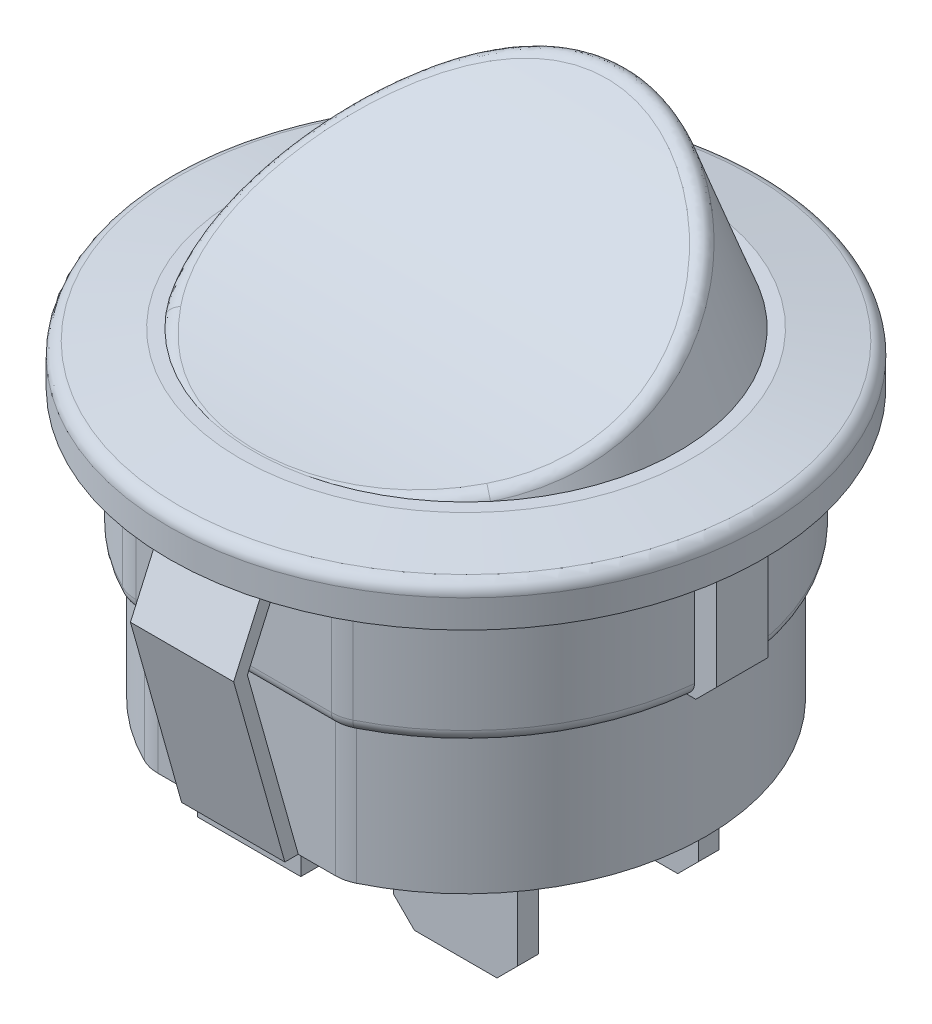
from build123d import *

# Parameters (mm, degrees)
BOSS_EXTRUDE1_DEPTH = 5
SKETCH2_R           = 11.5
BOSS_EXTRUDE2_DEPTH = 2
CHAMFER1_SIZE       = 0.5
CHAMFER1_SIZE2      = 2.75
BOSS_EXTRUDE3_DEPTH = 5.4
SKETCH4_W           = 4.8
SKETCH4_H           = 0.8
BOSS_EXTRUDE4_DEPTH = 8.4
SKETCH5_R           = 0.8
CUT_EXTRUDE1_DEPTH  = 26.045957758
BOSS_EXTRUDE5_DEPTH = 5
CHAMFER2_SIZE       = 0.8
BOSS_EXTRUDE6_DEPTH = 2
SKETCH8_W           = 4
SKETCH8_H           = 1
BOSS_EXTRUDE7_DEPTH = 0.8
CHAMFER3_SIZE       = 0.8
SKETCH9_R           = 8.25
BOSS_EXTRUDE8_DEPTH = 6.2
BOSS_EXTRUDE8_TAPER = 20
SKETCH10_R          = 20.629628058
CUT_EXTRUDE3_DEPTH  = 15
FILLET2_R           = 1.5
FILLET4_R           = 0.5
FILLET5_R           = 0.5
FILLET6_R           = 0.5


with BuildPart() as part:
    # Sketch1 → Boss-Extrude1 (new body)
    with BuildSketch(Plane(origin=(0, 0, 0), x_dir=(1, 0, 0), z_dir=(0, 1, 0))):
        with BuildLine():
            Line((4.124318125, -9), (-4.124318125, -9))
            ThreePointArc((-4.124318125, -9), (-9.9, 0), (-4.124318125, 9))
            Line((-4.124318125, 9), (4.124318125, 9))
            ThreePointArc((4.124318125, 9), (9.9, 0), (4.124318125, -9))
        make_face()
    extrude(amount=-BOSS_EXTRUDE1_DEPTH)

    # Sketch2 → Boss-Extrude2 (add)
    with BuildSketch(Plane(origin=(0, 0, 0), x_dir=(1, 0, 0), z_dir=(0, 1, 0))):
        with Locations(Location((0, 0, 0), (0, 0, 270))):
            Circle(SKETCH2_R)
    extrude(amount=BOSS_EXTRUDE2_DEPTH)

    # Chamfer1
    chamfer1_edges = [part.edges().sort_by_distance(p)[0] for p in [
        (0, 2, -11.5),
    ]]
    chamfer1_side = [part.faces().sort_by_distance(p)[0] for p in [
        (0, 1, -11.5),
    ]]
    chamfer(chamfer1_edges, length=CHAMFER1_SIZE, length2=CHAMFER1_SIZE2, reference=chamfer1_side[0])

    # Sketch3 → Boss-Extrude3 (add)
    with BuildSketch(Plane.XZ.offset(5)):
        with BuildLine():
            Line((-3.773592453, 8.5), (3.773592453, 8.5))
            ThreePointArc((3.773592453, 8.5), (9.3, 0), (3.773592453, -8.5))
            Line((3.773592453, -8.5), (-3.773592453, -8.5))
            ThreePointArc((-3.773592453, -8.5), (-9.3, 0), (-3.773592453, 8.5))
        make_face()
    extrude(amount=BOSS_EXTRUDE3_DEPTH)

    # Sketch4 → Boss-Extrude4 (add)
    with BuildSketch(Plane.XZ.offset(10.4)):
        Rectangle(SKETCH4_W, SKETCH4_H)
        with Locations((0, -7)):
            Rectangle(SKETCH4_W, SKETCH4_H)
    extrude(amount=BOSS_EXTRUDE4_DEPTH)

    # Sketch5 → Cut-Extrude1 (cut, through all)
    with BuildSketch(Plane.XY.offset(0.4)):
        with Locations((0, -15.4)):
            Circle(SKETCH5_R)
        with Locations((-2.4, -12.9)):
            Circle(SKETCH5_R)
        with Locations((2.4, -12.9)):
            Circle(SKETCH5_R)
    extrude(amount=-CUT_EXTRUDE1_DEPTH, mode=Mode.SUBTRACT)

    # Sketch6 → Boss-Extrude5 (add)
    with BuildSketch(Plane.XZ):
        with BuildLine():
            Line((10.7, -1), (10.7, 1))
            Line((10.7, 1), (9.849365462, 1))
            ThreePointArc((9.849365462, 1), (9.9, 0), (9.849365462, -1))
            Line((9.849365462, -1), (10.7, -1))
        make_face()
    extrude(amount=BOSS_EXTRUDE5_DEPTH)

    # Chamfer2
    chamfer2_edges = [part.edges().sort_by_distance(p)[0] for p in [
        (10.7, -5, 0),
    ]]
    chamfer(chamfer2_edges, length=CHAMFER2_SIZE)

    # Sketch7 → Boss-Extrude6 (add, symmetric)
    with BuildSketch(Plane(origin=(0, 0, 0), x_dir=(0, 0, -1), z_dir=(1, 0, 0))):
        Polygon((-9.5, 0), (-11, -3.364211825), (-9.018087581, -10.4), (-8.5, -10.4), (-8.5, -10.395132534), (-10.46970443, -3.402682715), (-9, -0.106418033), (-9, 0), align=None)
    boss_extrude6 = extrude(amount=BOSS_EXTRUDE6_DEPTH, both=True)

    # Mirror1: Boss-Extrude6 across plane
    add(boss_extrude6.mirror(Plane.XY))

    # Sketch8 → Boss-Extrude7 (add)
    with BuildSketch(Plane.XZ.offset(10.4)):
        with Locations((0, -7.9)):
            Rectangle(SKETCH8_W, SKETCH8_H)
        with Locations((0, -0.9)):
            Rectangle(SKETCH8_W, SKETCH8_H)
        with Locations((0, -6.1)):
            Rectangle(SKETCH8_W, SKETCH8_H)
        with Locations((0, 0.9)):
            Rectangle(SKETCH8_W, SKETCH8_H)
        with Locations((0, 6.1)):
            Rectangle(SKETCH8_W, SKETCH8_H)
        with Locations((0, 7.9)):
            Rectangle(SKETCH8_W, SKETCH8_H)
    extrude(amount=BOSS_EXTRUDE7_DEPTH)

    # Chamfer3
    chamfer3_edges = [part.edges().sort_by_distance(p)[0] for p in [
        (-2.4, -18.8, 0),
        (2.4, -18.8, 0),
        (-2.4, -18.8, -7),
        (2.4, -18.8, -7),
    ]]
    chamfer(chamfer3_edges, length=CHAMFER3_SIZE)

    # Sketch9 → Boss-Extrude8 (add)
    with BuildSketch(Plane(origin=(0, 2, 0), x_dir=(1, 0, 0), z_dir=(0, 1, 0))):
        Circle(SKETCH9_R)
    extrude(amount=BOSS_EXTRUDE8_DEPTH, taper=BOSS_EXTRUDE8_TAPER)

    # Sketch10 → Cut-Extrude3 (cut, symmetric)
    with BuildSketch(Plane(origin=(0, 0, 0), x_dir=(0, 0, -1), z_dir=(1, 0, 0))):
        with Locations((-8.75, 22.629628058)):
            Circle(SKETCH10_R)
    extrude(amount=CUT_EXTRUDE3_DEPTH, both=True, mode=Mode.SUBTRACT)

    # Fillet2
    fillet2_edges = [part.edges().sort_by_distance(p)[0] for p in [
        (-3.773592453, -7.7, 8.5),
        (-3.773592453, -7.7, -8.5),
        (3.773592453, -7.7, -8.5),
        (3.773592453, -7.7, 8.5),
        (4.124318125, -2.5, 9),
        (-4.124318125, -2.5, 9),
        (-4.124318125, -2.5, -9),
        (4.124318125, -2.5, -9),
    ]]
    fillet(fillet2_edges, radius=FILLET2_R)

    # Fillet4
    fillet4_edges = [part.edges().sort_by_distance(p)[0] for p in [
        (8.157290945, -5, -5.609688444),
        (0, -5, 9),
        (8.157290945, -5, 5.609688444),
        (-9.9, -5, 0),
        (0, -5, -9),
        (4.130038601, -5, -8.959268408),
        (-4.130038601, -5, -8.959268408),
        (-4.130038601, -5, 8.959268408),
        (4.130038601, -5, 8.959268408),
    ]]
    fillet(fillet4_edges, radius=FILLET4_R - 0.0001)  # a hair under: the kernel refuses the full size

    # Fillet5
    fillet5_edges = [part.edges().sort_by_distance(p)[0] for p in [
        (-7.627187422, 3.331798231, 1.457859139),
    ]]
    fillet(fillet5_edges, radius=FILLET5_R)

    # Fillet6
    fillet6_edges = [part.edges().sort_by_distance(p)[0] for p in [
        (0, 1.5, -11.5),
    ]]
    fillet(fillet6_edges, radius=FILLET6_R)


solid = part.part
